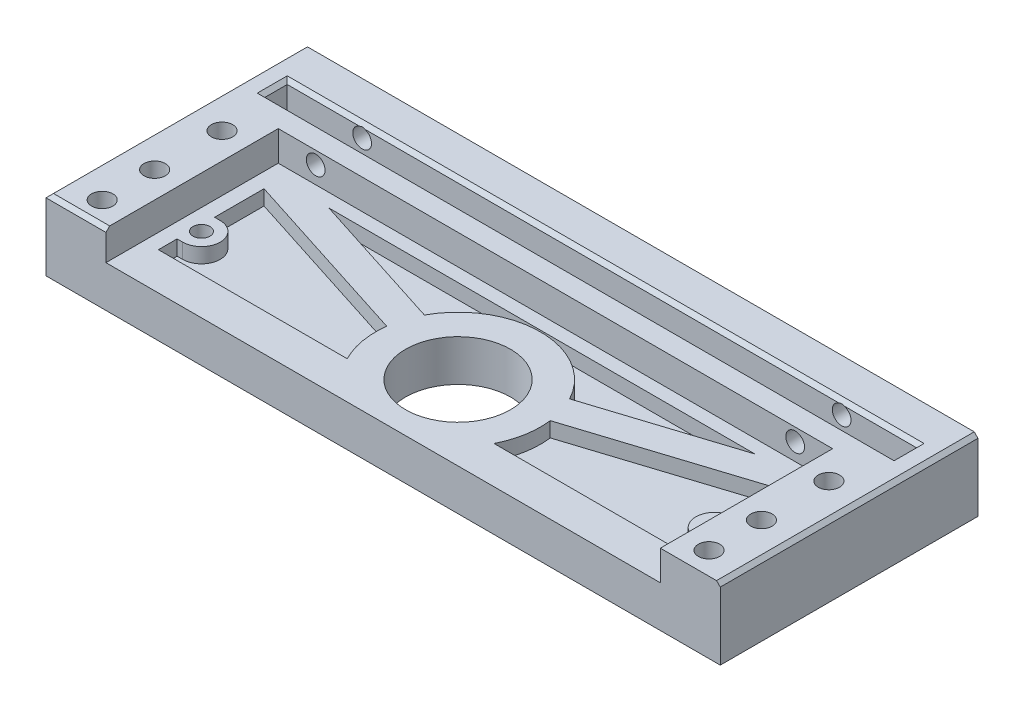
from build123d import *

# Parameters (mm, degrees)
SKETCH1_W               = 90
SKETCH1_H               = 9.525
SKETCH1_R               = 2
BOSS_EXTRUDE1_DEPTH     = 45
SKETCH2_R               = 7
CUT_EXTRUDE2_DEPTH      = 10
SKETCH3_R               = 1.4224
SKETCH3_R_2             = 7
SKETCH3_R_3             = 1.1303
CUT_EXTRUDE3_DEPTH      = 10
SKETCH4_W               = 84
SKETCH4_H               = 3
CUT_EXTRUDE4_DEPTH      = 6
CUT_EXTRUDE6_DEPTH      = 102.072872844
CUT_EXTRUDE6_DEPTH_BACK = 6
SKETCH7_W               = 90
SKETCH7_H               = 3
CUT_EXTRUDE7_DEPTH      = 10
SKETCH9_W               = 74
SKETCH9_H               = 23
CUT_EXTRUDE8_DEPTH      = 4
CUT_EXTRUDE9_REACH      = 95.379
SKETCH10_R              = 1.25
CHAMFER2_SIZE           = 0.5
SKETCH11_R              = 1.4224
CUT_EXTRUDE10_DEPTH     = 10
SKETCH12_W              = 100.09511362
SKETCH12_H              = 20.870657589
CUT_EXTRUDE11_DEPTH     = 10


with BuildPart() as part:
    # Sketch1 → Boss-Extrude1 (new body)
    # profile 1 of 3: a face of its own
    with BuildSketch(Plane.XY):
        with Locations((45, 4.7625)):
            Rectangle(SKETCH1_W, SKETCH1_H)
        with Locations((60, 4.7625)):
            Circle(SKETCH1_R, mode=Mode.SUBTRACT)
        with Locations((30, 4.7625)):
            Circle(SKETCH1_R, mode=Mode.SUBTRACT)
    # profile 2 of 3: a face of its own
    with BuildSketch(Plane.XY):
        with Locations((30, 4.7625)):
            Circle(SKETCH1_R)
    # profile 3 of 3: a face of its own
    with BuildSketch(Plane.XY):
        with Locations((60, 4.7625)):
            Circle(SKETCH1_R)
    extrude(amount=BOSS_EXTRUDE1_DEPTH)

    # Sketch2 → Cut-Extrude2 (cut)
    with BuildSketch(Plane(origin=(0, 9.525, 0), x_dir=(1, 0, 0), z_dir=(0, 1, 0))):
        with Locations(Location((45, -35, 0), (0, 0, 270))):
            Circle(SKETCH2_R)
    extrude(amount=-CUT_EXTRUDE2_DEPTH, mode=Mode.SUBTRACT)

    # Sketch3 → Cut-Extrude3 (cut)
    with BuildSketch(Plane(origin=(0, 9.525, 0), x_dir=(1, 0, 0), z_dir=(0, 1, 0))):
        with Locations(Location((85.5, -35, 0), (0, 0, 270))):
            Circle(SKETCH3_R)
        with Locations(Location((4.5, -35, 0), (0, 0, 270))):
            Circle(SKETCH3_R)
        with Locations(Location((45, -35, 0), (0, 0, 270))):
            Circle(SKETCH3_R_2)
        with Locations(Location((85.5, -26, 0), (0, 0, 270))):
            Circle(SKETCH3_R)
        with Locations(Location((4.5, -26, 0), (0, 0, 270))):
            Circle(SKETCH3_R)
        with Locations(Location((79.25, -35, 0), (0, 0, 270))):
            Circle(SKETCH3_R_3)
        with Locations(Location((10.75, -35, 0), (0, 0, 270))):
            Circle(SKETCH3_R_3)
    extrude(amount=-CUT_EXTRUDE3_DEPTH, mode=Mode.SUBTRACT)

    # Sketch4 → Cut-Extrude4 (cut)
    with BuildSketch(Plane(origin=(0, 9.525, 0), x_dir=(1, 0, 0), z_dir=(0, 1, 0))):
        with Locations((45, -17.3)):
            Rectangle(SKETCH4_W, SKETCH4_H)
    extrude(amount=-CUT_EXTRUDE4_DEPTH, mode=Mode.SUBTRACT)

    # Sketch6 → Cut-Extrude6 (cut, two sides: drawn at the far end of the back side and taken through both)
    with BuildSketch(Plane(origin=(0, 9.525, 0), x_dir=(1, 0, 0), z_dir=(0, 1, 0)).offset(-CUT_EXTRUDE6_DEPTH_BACK)):
        with BuildLine():
            ThreePointArc((10.75, -32.5), (13.25, -35), (10.75, -37.5))
            Line((10.75, -37.5), (10, -37.5))
            Line((10, -37.5), (10, -40))
            Line((10, -40), (35.202041029, -40))
            ThreePointArc((35.202041029, -40), (34.163248317, -36.888071228), (34.08840625, -33.60819476))
            Line((34.08840625, -33.60819476), (10, -25.89990476))
            Line((10, -25.89990476), (10, -32.5))
            Line((10, -32.5), (10.75, -32.5))
        make_face()
        with BuildLine():
            Line((16.562202374, -23.8), (35.307509158, -29.798498171))
            ThreePointArc((35.307509158, -29.798498171), (45, -24), (54.692490842, -29.798498171))
            Line((54.692490842, -29.798498171), (73.437797626, -23.8))
            Line((73.437797626, -23.8), (16.562202374, -23.8))
        make_face()
        with BuildLine():
            ThreePointArc((55.91159375, -33.60819476), (55.836751683, -36.888071228), (54.797958971, -40))
            Line((54.797958971, -40), (80, -40))
            Line((80, -40), (80, -37.5))
            Line((80, -37.5), (79.25, -37.5))
            ThreePointArc((79.25, -37.5), (76.75, -35), (79.25, -32.5))
            Line((79.25, -32.5), (80, -32.5))
            Line((80, -32.5), (80, -25.89990476))
            Line((80, -25.89990476), (55.91159375, -33.60819476))
        make_face()
    extrude(amount=CUT_EXTRUDE6_DEPTH + CUT_EXTRUDE6_DEPTH_BACK, mode=Mode.SUBTRACT)

    # Sketch7 → Cut-Extrude7 (cut)
    with BuildSketch(Plane(origin=(0, 9.525, 0), x_dir=(1, 0, 0), z_dir=(0, 1, 0))):
        with Locations((45, -1.5)):
            Rectangle(SKETCH7_W, SKETCH7_H)
    extrude(amount=-CUT_EXTRUDE7_DEPTH, mode=Mode.SUBTRACT)

    # Sketch9 → Cut-Extrude8 (cut)
    with BuildSketch(Plane(origin=(0, 9.525, 0), x_dir=(1, 0, 0), z_dir=(0, 1, 0))):
        with Locations((45, -33.5)):
            Rectangle(SKETCH9_W, SKETCH9_H)
    extrude(amount=-CUT_EXTRUDE8_DEPTH, mode=Mode.SUBTRACT)

    # Cut-Extrude9: up to this face of the body (flat: up to its plane)
    cut_extrude9_end = Plane(part.part.faces().sort_by_distance((45, 4.7625, 3))[0])
    # Sketch10 → Cut-Extrude9 (cut, up to the picked face)
    with BuildSketch(Plane.XY.offset(22), mode=Mode.PRIVATE) as cut_extrude9_sk1:
        with Locations((77, 7.825)):
            Circle(SKETCH10_R)
    cut_extrude9_tool1 = split(extrude(cut_extrude9_sk1.sketch, amount=-CUT_EXTRUDE9_REACH, mode=Mode.PRIVATE), bisect_by=cut_extrude9_end, keep=Keep.BOTH, mode=Mode.PRIVATE)
    # Sketch10 → Cut-Extrude9 (cut, up to the picked face)
    with BuildSketch(Plane.XY.offset(22), mode=Mode.PRIVATE) as cut_extrude9_sk2:
        with Locations((13, 7.825)):
            Circle(SKETCH10_R)
    cut_extrude9_tool2 = split(extrude(cut_extrude9_sk2.sketch, amount=-CUT_EXTRUDE9_REACH, mode=Mode.PRIVATE), bisect_by=cut_extrude9_end, keep=Keep.BOTH, mode=Mode.PRIVATE)
    add(cut_extrude9_tool1.solids().sort_by(Axis((77, 7.825, 22), (0, 0, -1)))[0], mode=Mode.SUBTRACT)
    add(cut_extrude9_tool2.solids().sort_by(Axis((13, 7.825, 22), (0, 0, -1)))[0], mode=Mode.SUBTRACT)

    # Chamfer2
    # the kernel refuses this chamfer: 0.5 mm, written as the material it takes off along each edge
    with BuildSketch(Plane(origin=(9.285841494, 9.525, 45), x_dir=(0, -0.999621916911297, 0.0274958766105822), z_dir=(-1, 0, 0))) as chamfer2_piece_1:
        Polygon((CHAMFER2_SIZE * 0.999621916911, -CHAMFER2_SIZE * 0.0274958766106), (-CHAMFER2_SIZE * 0.0274958766106, -CHAMFER2_SIZE * 0.999621916911), (0, 0), align=None)
    extrude(amount=10.571682988, mode=Mode.SUBTRACT)
    with BuildSketch(Plane(origin=(-1.285841494, 9.525, 3), x_dir=(0, -0.9996219169112968, -0.02749587661058651), z_dir=(1, 0, 0))) as chamfer2_piece_2:
        Polygon((CHAMFER2_SIZE * 0.999621916911, -CHAMFER2_SIZE * 0.0274958766106), (-CHAMFER2_SIZE * 0.0274958766106, -CHAMFER2_SIZE * 0.999621916911), (0, 0), align=None)
    extrude(amount=92.571682988, mode=Mode.SUBTRACT)
    with BuildSketch(Plane(origin=(87, 9.525, 18.8), x_dir=(0.999621916911297, 0.027495876610582292, 0), z_dir=(0, 0, -1)), Plane(origin=(3, 9.525, 15.8), x_dir=(-0.9996219169112968, 0.027495876610585408, -1.035816383536533e-15), z_dir=(0, 0, 1))) as chamfer2_piece_3:
        Polygon((CHAMFER2_SIZE * 0.999621916911, CHAMFER2_SIZE * 0.0274958766106), (-CHAMFER2_SIZE * 0.0274958766106, CHAMFER2_SIZE * 0.999621916911), (0, 0), align=None)
    extrude(amount=3, mode=Mode.SUBTRACT)
    with BuildSketch(Plane(origin=(87, 9.525, 15.8), x_dir=(0, 0.0274958766105822, -0.999621916911297), z_dir=(-1, 0, 0)), Plane(origin=(3, 9.525, 18.8), x_dir=(0, 0.02749587661058555, 0.9996219169112968), z_dir=(1, 0, 0))) as chamfer2_piece_4:
        Polygon((CHAMFER2_SIZE * 0.999621916911, CHAMFER2_SIZE * 0.0274958766106), (-CHAMFER2_SIZE * 0.0274958766106, CHAMFER2_SIZE * 0.999621916911), (0, 0), align=None)
    extrude(amount=84, mode=Mode.SUBTRACT)
    with BuildSketch(Plane(origin=(0, 9.525, 1.714158506), x_dir=(-0.02749587661058639, -0.9996219169112968, 0), z_dir=(0, 0, 1))) as chamfer2_piece_5:
        Polygon((CHAMFER2_SIZE * 0.999621916911, CHAMFER2_SIZE * 0.0274958766106), (-CHAMFER2_SIZE * 0.0274958766106, CHAMFER2_SIZE * 0.999621916911), (0, 0), align=None)
    extrude(amount=44.571682988, mode=Mode.SUBTRACT)
    with BuildSketch(Plane(origin=(90, 9.525, 1.714158506), x_dir=(0.0274958766105822, -0.999621916911297, 0), z_dir=(0, 0, 1))) as chamfer2_piece_6:
        Polygon((CHAMFER2_SIZE * 0.999621916911, -CHAMFER2_SIZE * 0.0274958766106), (-CHAMFER2_SIZE * 0.0274958766106, -CHAMFER2_SIZE * 0.999621916911), (0, 0), align=None)
    extrude(amount=44.571682988, mode=Mode.SUBTRACT)
    with BuildSketch(Plane(origin=(87, 9.525, 20.085841494), x_dir=(0.9996219169112968, 0.02749587661058574, 0), z_dir=(0, 0, -1))) as chamfer2_piece_7a_section:
        Polygon((CHAMFER2_SIZE * 0.999621916911, CHAMFER2_SIZE * 0.0274958766106), (-CHAMFER2_SIZE * 0.0274958766106, CHAMFER2_SIZE * 0.999621916911), (0, 0), align=None)
    chamfer2_piece_7a = extrude(amount=4.285841494, mode=Mode.PRIVATE)
    chamfer2_piece_7a = split(chamfer2_piece_7a, bisect_by=Plane(origin=(87.164896813, 9.360103187, 18.8), z_dir=(0, 0, 1)), keep=Keep.TOP, mode=Mode.PRIVATE)
    with BuildSketch(Plane(origin=(3, 9.525, 18.8), x_dir=(0, 0.02749587661058555, 0.9996219169112968), z_dir=(1, 0, 0))) as chamfer2_piece_7b_section:
        Polygon((CHAMFER2_SIZE * 0.999621916911, CHAMFER2_SIZE * 0.0274958766106), (-CHAMFER2_SIZE * 0.0274958766106, CHAMFER2_SIZE * 0.999621916911), (0, 0), align=None)
    chamfer2_piece_7b = extrude(amount=85.285841494, mode=Mode.PRIVATE)
    chamfer2_piece_7b = split(chamfer2_piece_7b, bisect_by=Plane(origin=(87, 9.360103187, 18.964896813), z_dir=(1, 0, 0)), keep=Keep.TOP, mode=Mode.PRIVATE)
    chamfer2_piece_7 = chamfer2_piece_7a & chamfer2_piece_7b
    add(chamfer2_piece_7, mode=Mode.SUBTRACT)
    with BuildSketch(Plane(origin=(87, 9.525, 18.8), x_dir=(0.999621916911297, 0.027495876610582292, 0), z_dir=(0, 0, -1))) as chamfer2_piece_8a_section:
        Polygon((CHAMFER2_SIZE * 0.999621916911, CHAMFER2_SIZE * 0.0274958766106), (-CHAMFER2_SIZE * 0.0274958766106, CHAMFER2_SIZE * 0.999621916911), (0, 0), align=None)
    chamfer2_piece_8a = extrude(amount=4.285841494, mode=Mode.PRIVATE)
    chamfer2_piece_8a = split(chamfer2_piece_8a, bisect_by=Plane(origin=(87.164896813, 9.360103187, 15.8), z_dir=(0, 0, -1)), keep=Keep.TOP, mode=Mode.PRIVATE)
    with BuildSketch(Plane(origin=(88.285841494, 9.525, 15.8), x_dir=(0, 0.027495876610585647, -0.9996219169112968), z_dir=(-1, 0, 0))) as chamfer2_piece_8b_section:
        Polygon((CHAMFER2_SIZE * 0.999621916911, CHAMFER2_SIZE * 0.0274958766106), (-CHAMFER2_SIZE * 0.0274958766106, CHAMFER2_SIZE * 0.999621916911), (0, 0), align=None)
    chamfer2_piece_8b = extrude(amount=85.285841494, mode=Mode.PRIVATE)
    chamfer2_piece_8b = split(chamfer2_piece_8b, bisect_by=Plane(origin=(87, 9.360103187, 15.635103187), z_dir=(1, 0, 0)), keep=Keep.TOP, mode=Mode.PRIVATE)
    chamfer2_piece_8 = chamfer2_piece_8a & chamfer2_piece_8b
    add(chamfer2_piece_8, mode=Mode.SUBTRACT)
    with BuildSketch(Plane(origin=(87, 9.525, 15.8), x_dir=(0, 0.0274958766105822, -0.999621916911297), z_dir=(-1, 0, 0))) as chamfer2_piece_9a_section:
        Polygon((CHAMFER2_SIZE * 0.999621916911, CHAMFER2_SIZE * 0.0274958766106), (-CHAMFER2_SIZE * 0.0274958766106, CHAMFER2_SIZE * 0.999621916911), (0, 0), align=None)
    chamfer2_piece_9a = extrude(amount=85.285841494, mode=Mode.PRIVATE)
    chamfer2_piece_9a = split(chamfer2_piece_9a, bisect_by=Plane(origin=(3, 9.360103187, 15.635103187), z_dir=(-1, 0, 0)), keep=Keep.TOP, mode=Mode.PRIVATE)
    with BuildSketch(Plane(origin=(3, 9.525, 14.514158506), x_dir=(-0.9996219169112968, 0.027495876610585623, -1.035816383536533e-15), z_dir=(0, 0, 1))) as chamfer2_piece_9b_section:
        Polygon((CHAMFER2_SIZE * 0.999621916911, CHAMFER2_SIZE * 0.0274958766106), (-CHAMFER2_SIZE * 0.0274958766106, CHAMFER2_SIZE * 0.999621916911), (0, 0), align=None)
    chamfer2_piece_9b = extrude(amount=4.285841494, mode=Mode.PRIVATE)
    chamfer2_piece_9b = split(chamfer2_piece_9b, bisect_by=Plane(origin=(2.835103187, 9.360103187, 15.8), z_dir=(0, 0, -1)), keep=Keep.TOP, mode=Mode.PRIVATE)
    chamfer2_piece_9 = chamfer2_piece_9a & chamfer2_piece_9b
    add(chamfer2_piece_9, mode=Mode.SUBTRACT)
    with BuildSketch(Plane(origin=(1.714158506, 9.525, 18.8), x_dir=(0, 0.02749587661058555, 0.9996219169112968), z_dir=(1, 0, 0))) as chamfer2_piece_10a_section:
        Polygon((CHAMFER2_SIZE * 0.999621916911, CHAMFER2_SIZE * 0.0274958766106), (-CHAMFER2_SIZE * 0.0274958766106, CHAMFER2_SIZE * 0.999621916911), (0, 0), align=None)
    chamfer2_piece_10a = extrude(amount=85.285841494, mode=Mode.PRIVATE)
    chamfer2_piece_10a = split(chamfer2_piece_10a, bisect_by=Plane(origin=(3, 9.360103187, 18.964896813), z_dir=(-1, 0, 0)), keep=Keep.TOP, mode=Mode.PRIVATE)
    with BuildSketch(Plane(origin=(3, 9.525, 15.8), x_dir=(-0.9996219169112968, 0.027495876610585408, -1.035816383536533e-15), z_dir=(0, 0, 1))) as chamfer2_piece_10b_section:
        Polygon((CHAMFER2_SIZE * 0.999621916911, CHAMFER2_SIZE * 0.0274958766106), (-CHAMFER2_SIZE * 0.0274958766106, CHAMFER2_SIZE * 0.999621916911), (0, 0), align=None)
    chamfer2_piece_10b = extrude(amount=4.285841494, mode=Mode.PRIVATE)
    chamfer2_piece_10b = split(chamfer2_piece_10b, bisect_by=Plane(origin=(2.835103187, 9.360103187, 18.8), z_dir=(0, 0, 1)), keep=Keep.TOP, mode=Mode.PRIVATE)
    chamfer2_piece_10 = chamfer2_piece_10a & chamfer2_piece_10b
    add(chamfer2_piece_10, mode=Mode.SUBTRACT)

    # Sketch11 → Cut-Extrude10 (cut)
    with BuildSketch(Plane(origin=(0, 9.525, 0), x_dir=(1, 0, 0), z_dir=(0, 1, 0))):
        with Locations(Location((85.5, -42, 0), (0, 0, 180))):
            Circle(SKETCH11_R)
        with Locations(Location((4.5, -42, 0), (0, 0, 180))):
            Circle(SKETCH11_R)
    extrude(amount=-CUT_EXTRUDE10_DEPTH, mode=Mode.SUBTRACT)

    # Sketch12 → Cut-Extrude11 (cut)
    with BuildSketch(Plane(origin=(0, 9.525, 0), x_dir=(1, 0, 0), z_dir=(0, 1, 0))):
        with Locations((41.282725073, -0.164671206)):
            Rectangle(SKETCH12_W, SKETCH12_H)
    extrude(amount=-CUT_EXTRUDE11_DEPTH, mode=Mode.SUBTRACT)


solid = part.part
